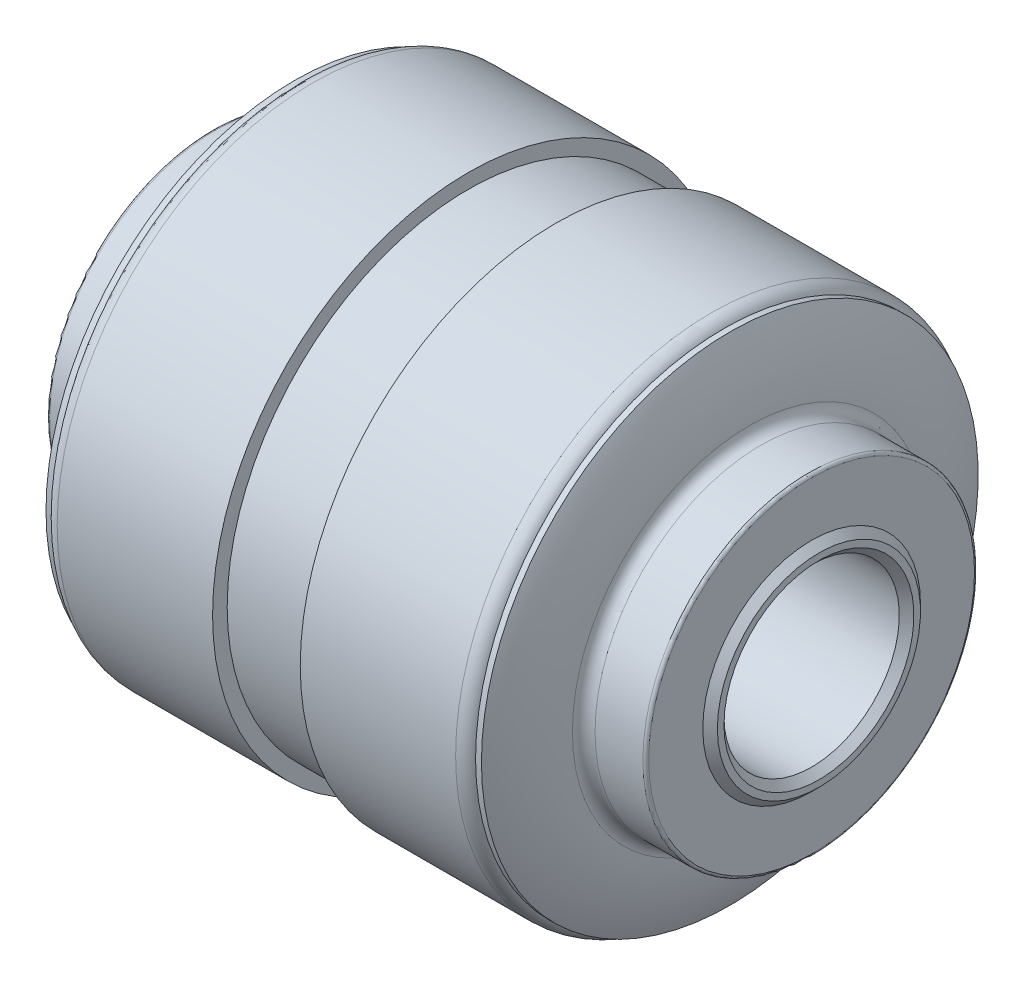
from build123d import *

# Parameters (mm, degrees)
CHAMFER1_SIZE = 0.5
FILLET1_R     = 0.2
FILLET2_R     = 0.8
FILLET3_R     = 1


# Some blends are built 0.0001 mm under size
with BuildPart() as part:
    # Sketch1 → Revolve1 (revolve)
    with BuildSketch(Plane.XY, mode=Mode.PRIVATE) as revolve1_sk:
        Polygon((0, 6), (21, 6), (21, 7.45), (20.5, 7.45), (20.5, 11.35), (16.25, 11.35), (16.25, 17), (14.5, 17), (14.5, 17.5), (3, 17.5), (3, 16.5), (0, 16.5), align=None)
    revolve1 = revolve(revolve1_sk.sketch.rotate(Axis((-88.99, 0, 0), (1, 0, 0)), 90), axis=Axis((-88.99, 0, 0), (1, 0, 0)))

    # Sketch2 → Cut-Revolve1 (revolve, cut)
    with BuildSketch(Plane.XY, mode=Mode.PRIVATE) as cut_revolve1_sk:
        with BuildLine():
            Line((14.632439984, 17.5), (16.25, 17.5))
            Line((16.25, 17.5), (16.25, 11.35))
            ThreePointArc((16.25, 11.35), (15.838848163, 14.529583322), (14.632439984, 17.5))
        make_face()
    cut_revolve1 = revolve(cut_revolve1_sk.sketch.rotate(Axis((-88.99, 0, 0), (1, 0, 0)), 90), axis=Axis((-88.99, 0, 0), (1, 0, 0)), mode=Mode.SUBTRACT)

    # Mirror1: Revolve1, Cut-Revolve1 across plane
    add(revolve1.mirror(Plane(origin=(0, 0, 0), x_dir=(0, 0, 1), z_dir=(1, 0, 0))))
    add(cut_revolve1.mirror(Plane(origin=(0, 0, 0), x_dir=(0, 0, 1), z_dir=(1, 0, 0))), mode=Mode.SUBTRACT)

    # Chamfer1
    chamfer1_edges = [part.edges().sort_by_distance(p)[0] for p in [
        (21, 0, -7.45),
        (21, 0, -6),
        (-21, 0, -6),
        (-21, 0, -7.45),
    ]]
    chamfer(chamfer1_edges, length=CHAMFER1_SIZE - 0.0001)  # a hair under: the kernel refuses the full size

    # Fillet1
    fillet1_edges = [part.edges().sort_by_distance(p)[0] for p in [
        (20.5, 0, -11.35),
        (-20.5, 0, -11.35),
    ]]
    fillet(fillet1_edges, radius=FILLET1_R)

    # Fillet2
    fillet2_edges = [part.edges().sort_by_distance(p)[0] for p in [
        (16.25, 0, -11.35),
        (-16.25, 0, -11.35),
    ]]
    fillet(fillet2_edges, radius=FILLET2_R)

    # Fillet3
    # the kernel refuses this fillet: 1 mm, written as the material it takes off along each edge
    with BuildSketch(Plane(origin=(-14.5, 0, 0), x_dir=(0, 0, 1), z_dir=(0, 1, 0))) as fillet3_piece_1:
        with BuildLine():
            CenterArc((16.5, 0.866025404), FILLET3_R, 300, 60)
            Line((17, 0), (17.01, -0.017320508))
            ThreePointArc((17.01, -0.017320508), (17.25, -0.02), (17.5, -0.02))
            Line((17.5, -0.02), (17.52, 0))
            Line((17.52, 0), (17.52, 0.866025404))
            Line((17.52, 0.866025404), (17.5, 0.866025404))
        make_face()
    revolve(axis=Axis((-14.5, 0, 0), (1, 0, 0)), mode=Mode.SUBTRACT)
    with BuildSketch(Plane(origin=(14.5, 0, 0), x_dir=(0, 0, 1), z_dir=(0, 1, 0))) as fillet3_piece_2:
        with BuildLine():
            CenterArc((16.5, -0.866025404), FILLET3_R, 0, 60)
            Line((17.5, -0.866025404), (17.52, -0.866025404))
            Line((17.52, -0.866025404), (17.52, 0))
            Line((17.52, 0), (17.5, 0.02))
            ThreePointArc((17.5, 0.02), (17.25, 0.02), (17.01, 0.017320508))
            Line((17.01, 0.017320508), (17, 0))
        make_face()
    revolve(axis=Axis((14.5, 0, 0), (1, 0, 0)), mode=Mode.SUBTRACT)


solid = part.part
